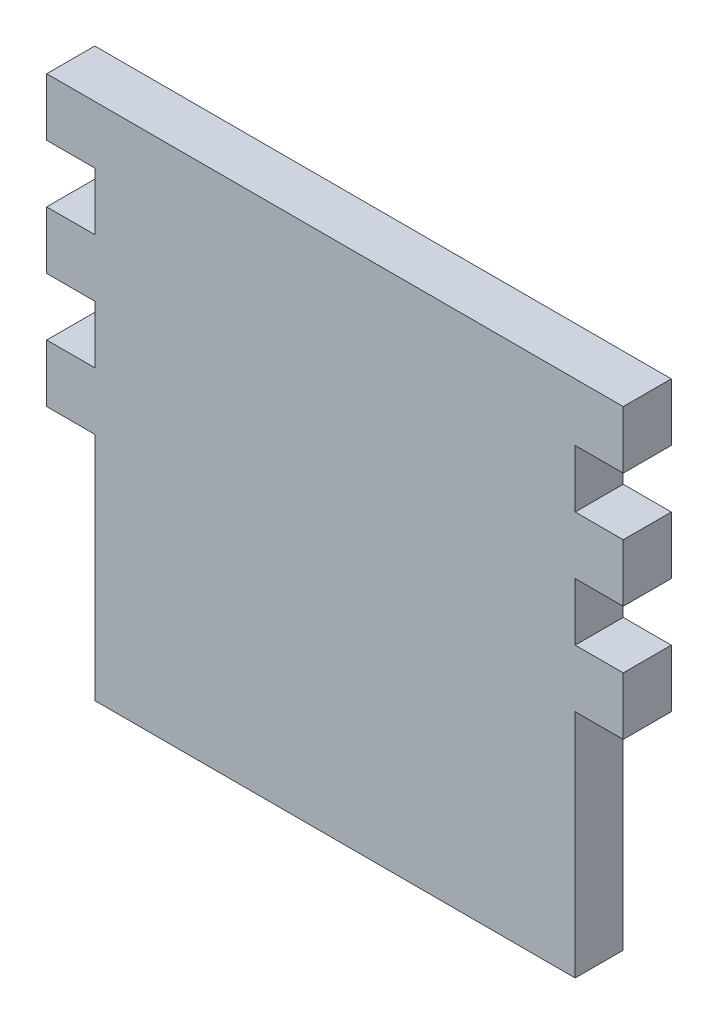
from build123d import *

# Parameters (mm, degrees)
SKETCH1_W           = 76.2
SKETCH1_H           = 76.2
BOSS_EXTRUDE1_DEPTH = 6.35
CUT_EXTRUDE1_DEPTH  = 6.35
SKETCH3_W           = 6.35
SKETCH3_H           = 38.1
CUT_EXTRUDE2_DEPTH  = 6.35
SKETCH4_W           = 6.35
SKETCH4_H           = 7.62
BOSS_EXTRUDE3_DEPTH = 6.35
SKETCH5_W           = 63.5
SKETCH5_H           = 6.35
CUT_EXTRUDE3_DEPTH  = 7.62


with BuildPart() as part:
    # Sketch1 → Boss-Extrude1 (new body)
    with BuildSketch(Plane.XY):
        with Locations((0.21991342, -21.056709957)):
            Rectangle(SKETCH1_W, SKETCH1_H)
    extrude(amount=BOSS_EXTRUDE1_DEPTH)

    # Sketch2 → Cut-Extrude1 (cut)
    with BuildSketch(Plane.XY.offset(6.35)):
        Polygon((-37.88008658, 17.043290043), (-31.53008658, 17.043290043), (-31.53008658, 9.423290043), (-37.88008658, 9.423290043), (-37.88008658, 1.803290043), (-31.53008658, 1.803290043), (-31.53008658, -5.816709957), (-37.88008658, -5.816709957), (-37.88008658, -13.436709957), (-31.53008658, -13.436709957), (-31.53008658, -21.056709957), (-37.88008658, -21.056709957), (-46.725849744, -21.056709957), (-46.725849744, 17.043290043), align=None)
        Polygon((47.165676584, -21.056709957), (47.165676584, 17.043290043), (38.31991342, 17.043290043), (31.96991342, 17.043290043), (31.96991342, 9.423290043), (38.31991342, 9.423290043), (38.31991342, 1.803290043), (31.96991342, 1.803290043), (31.96991342, -5.816709957), (38.31991342, -5.816709957), (38.31991342, -13.436709957), (31.96991342, -13.436709957), (31.96991342, -21.056709957), (38.31991342, -21.056709957), align=None)
    extrude(amount=-CUT_EXTRUDE1_DEPTH, mode=Mode.SUBTRACT)

    # Sketch3 → Cut-Extrude2 (cut)
    with BuildSketch(Plane.XY.offset(6.35)):
        with Locations((-34.70508658, -40.106709957)):
            Rectangle(SKETCH3_W, SKETCH3_H)
        with Locations((35.14491342, -40.106709957)):
            Rectangle(SKETCH3_W, SKETCH3_H)
    extrude(amount=-CUT_EXTRUDE2_DEPTH, mode=Mode.SUBTRACT)

    # Sketch4 → Boss-Extrude3 (add)
    with BuildSketch(Plane.XY.offset(6.35)):
        with Locations((-34.70508658, -24.866709957)):
            Rectangle(SKETCH4_W, SKETCH4_H)
        with Locations((35.14491342, -24.866709957)):
            Rectangle(SKETCH4_W, SKETCH4_H)
    extrude(amount=-BOSS_EXTRUDE3_DEPTH)

    # Sketch5 → Cut-Extrude3 (cut)
    with BuildSketch(Plane(origin=(0, 17.043290043, 0), x_dir=(1, 0, 0), z_dir=(0, 1, 0))):
        with Locations((0.21991342, -3.175)):
            Rectangle(SKETCH5_W, SKETCH5_H)
    extrude(amount=-CUT_EXTRUDE3_DEPTH, mode=Mode.SUBTRACT)


solid = part.part
